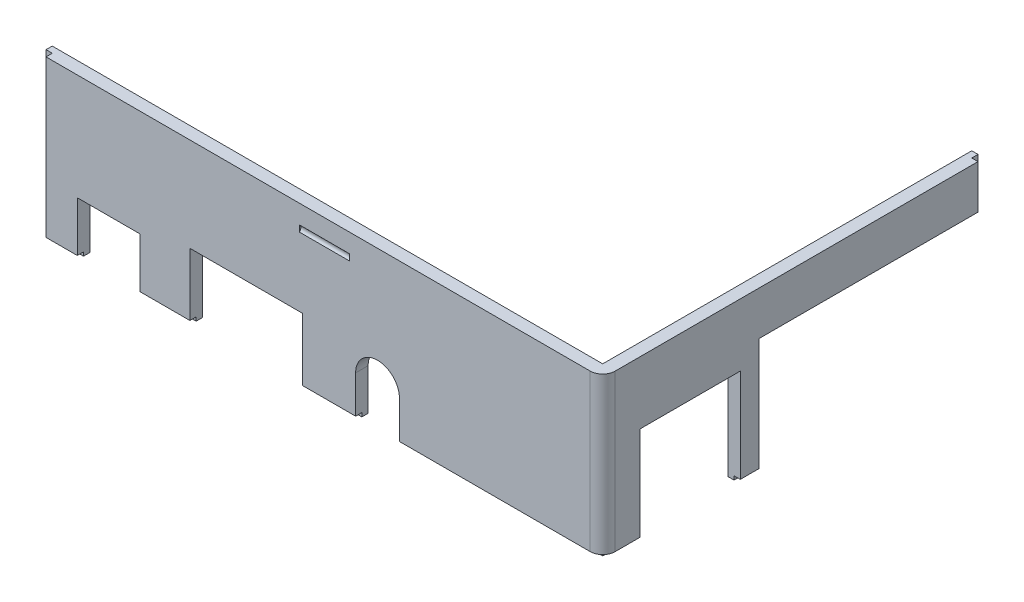
from build123d import *

# Parameters (mm, degrees)
P_IDAT_VYSUNUT_M1_DEPTH  = 25
SKICA2_W                 = 88
SKICA2_H                 = 1
P_IDAT_VYSUNUT_M2_DEPTH  = 0.6
ODEBRAT_VYSUNUT_M1_REACH = 113.562
SKICA5_W                 = 10
SKICA5_H                 = 8.6
SKICA5_W_2               = 18
SKICA5_H_2               = 10.6
ODEBRAT_VYSUNUT_M2_REACH = 113.562
SKICA6_W                 = 16
SKICA6_H                 = 15.6
SKICA6_W_2               = 19
SKICA6_H_2               = 18.6
FILLET1_R                = 2
CUT_EXTRUDE1_START       = -40.5
CUT_EXTRUDE1_DEPTH       = 8
CUT_EXTRUDE2_REACH       = 113.562
SKETCH2_W                = 1
SKETCH2_H                = 18.6


with BuildPart() as part:
    # Skica1 → Přidat vysunutím1 (new body)
    with BuildSketch(Plane(origin=(0, 0, 0), x_dir=(1, 0, 0), z_dir=(0, 1, 0))):
        Polygon((1, 1), (1, 0), (90, 0), (90, 60), (89, 60), (89, 61), (88, 61), (88, 2), (0, 2), (0, 1), align=None)
    extrude(amount=P_IDAT_VYSUNUT_M1_DEPTH)

    # Skica2 → Přidat vysunutím2 (add)
    with BuildSketch(Plane.XZ):
        with Locations((44, -1.5)):
            Rectangle(SKICA2_W, SKICA2_H)
        Polygon((89, -1), (88, -1), (88, -2), (88, -61), (89, -61), align=None)
    extrude(amount=P_IDAT_VYSUNUT_M2_DEPTH)

    # Skica5 → Odebrat vysunutím1 (cut, up to next)
    with BuildSketch(Plane.XY, mode=Mode.PRIVATE) as odebrat_vysunut_m1_sk1:
        with Locations((11, 3.7)):
            Rectangle(SKICA5_W, SKICA5_H)
    odebrat_vysunut_m1_tool1 = extrude(odebrat_vysunut_m1_sk1.sketch, amount=-ODEBRAT_VYSUNUT_M1_REACH, mode=Mode.PRIVATE) & part.part
    # Skica5 → Odebrat vysunutím1 (cut, up to next)
    with BuildSketch(Plane.XY, mode=Mode.PRIVATE) as odebrat_vysunut_m1_sk2:
        with Locations((33, 4.7)):
            Rectangle(SKICA5_W_2, SKICA5_H_2)
    odebrat_vysunut_m1_tool2 = extrude(odebrat_vysunut_m1_sk2.sketch, amount=-ODEBRAT_VYSUNUT_M1_REACH, mode=Mode.PRIVATE) & part.part
    # Skica5 → Odebrat vysunutím1 (cut, up to next)
    with BuildSketch(Plane.XY, mode=Mode.PRIVATE) as odebrat_vysunut_m1_sk3:
        with BuildLine():
            Line((50.5, 6), (50.5, -0.6))
            Line((50.5, -0.6), (57.5, -0.6))
            Line((57.5, -0.6), (57.5, 6))
            ThreePointArc((57.5, 6), (54, 9.5), (50.5, 6))
        make_face()
    odebrat_vysunut_m1_tool3 = extrude(odebrat_vysunut_m1_sk3.sketch, amount=-ODEBRAT_VYSUNUT_M1_REACH, mode=Mode.PRIVATE) & part.part
    add(odebrat_vysunut_m1_tool1.solids().sort_by_distance((11, 3.7, 0))[0], mode=Mode.SUBTRACT)
    add(odebrat_vysunut_m1_tool2.solids().sort_by_distance((33, 4.7, 0))[0], mode=Mode.SUBTRACT)
    add(odebrat_vysunut_m1_tool3.solids().sort_by_distance((54, 4.107084, 0))[0], mode=Mode.SUBTRACT)

    # Skica6 → Odebrat vysunutím2 (cut, up to next)
    with BuildSketch(Plane(origin=(90, 0, 0), x_dir=(0, 0, -1), z_dir=(1, 0, 0)), mode=Mode.PRIVATE) as odebrat_vysunut_m2_sk1:
        with Locations((14, 7.2)):
            Rectangle(SKICA6_W, SKICA6_H)
    odebrat_vysunut_m2_tool1 = extrude(odebrat_vysunut_m2_sk1.sketch, amount=-ODEBRAT_VYSUNUT_M2_REACH, mode=Mode.PRIVATE) & part.part
    # Skica6 → Odebrat vysunutím2 (cut, up to next)
    with BuildSketch(Plane(origin=(90, 0, 0), x_dir=(0, 0, -1), z_dir=(1, 0, 0)), mode=Mode.PRIVATE) as odebrat_vysunut_m2_sk2:
        with Locations((51.5, 8.7)):
            Rectangle(SKICA6_W_2, SKICA6_H_2)
    odebrat_vysunut_m2_tool2 = extrude(odebrat_vysunut_m2_sk2.sketch, amount=-ODEBRAT_VYSUNUT_M2_REACH, mode=Mode.PRIVATE) & part.part
    # Skica6 → Odebrat vysunutím2 (cut, up to next)
    with BuildSketch(Plane(origin=(90, 0, 0), x_dir=(0, 0, -1), z_dir=(1, 0, 0)), mode=Mode.PRIVATE) as odebrat_vysunut_m2_sk3:
        with Locations((33, 8.7)):
            Rectangle(SKICA6_W, SKICA6_H_2)
    odebrat_vysunut_m2_tool3 = extrude(odebrat_vysunut_m2_sk3.sketch, amount=-ODEBRAT_VYSUNUT_M2_REACH, mode=Mode.PRIVATE) & part.part
    add(odebrat_vysunut_m2_tool1.solids().sort_by_distance((90, 7.2, -14))[0], mode=Mode.SUBTRACT)
    add(odebrat_vysunut_m2_tool2.solids().sort_by_distance((90, 8.7, -51.5))[0], mode=Mode.SUBTRACT)
    add(odebrat_vysunut_m2_tool3.solids().sort_by_distance((90, 8.7, -33))[0], mode=Mode.SUBTRACT)

    # Fillet1
    fillet1_edges = [part.edges().sort_by_distance(p)[0] for p in [
        (90, 12.5, 0),
    ]]
    fillet(fillet1_edges, radius=FILLET1_R)

    # Sketch1 → Cut-Extrude1 (cut)
    with BuildSketch(Plane(origin=(90, 0, 0), x_dir=(0, 0, -1), z_dir=(1, 0, 0)).offset(CUT_EXTRUDE1_START)):
        with BuildLine():
            ThreePointArc((0, 21), (0.240312424, 21.5), (0, 22))
            Line((0, 22), (0, 21.5))
            Line((0, 21.5), (0, 21))
        make_face()
    extrude(amount=-CUT_EXTRUDE1_DEPTH, mode=Mode.SUBTRACT)

    # Sketch2 → Cut-Extrude2 (cut, up to next)
    with BuildSketch(Plane(origin=(90, 0, 0), x_dir=(0, 0, -1), z_dir=(1, 0, 0)), mode=Mode.PRIVATE) as cut_extrude2_sk1:
        with Locations((41.5, 8.7)):
            Rectangle(SKETCH2_W, SKETCH2_H)
    cut_extrude2_tool1 = extrude(cut_extrude2_sk1.sketch, amount=-CUT_EXTRUDE2_REACH, mode=Mode.PRIVATE) & part.part
    add(cut_extrude2_tool1.solids().sort_by_distance((90, 8.7, -41.5))[0], mode=Mode.SUBTRACT)


solid = part.part
